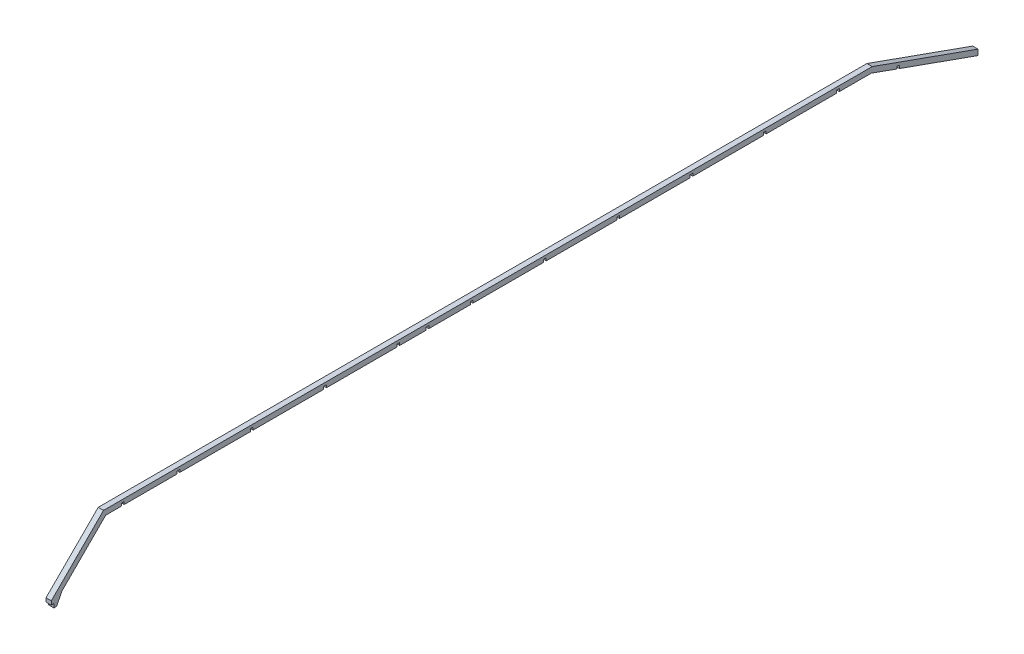
from build123d import *

# Parameters (mm, degrees)
EXTRUDE_3_DEPTH = 6


with BuildPart() as part:
    # Эскиз1 → Бобышка-Вытянуть3 (new body)
    with BuildSketch(Plane(origin=(0, 0, 0), x_dir=(0, 0, -1), z_dir=(1, 0, 0))):
        Polygon((-751.886625415, -19.142158624), (-733.960587786, -19.142158624), (-733.960587786, -16.142158624), (-730.960587786, -16.142158624), (-730.960587786, -19.142158624), (-670.960587786, -19.142158624), (-670.960587786, -16.142158624), (-667.960587786, -16.142158624), (-667.960587786, -19.142158624), (-587.960587786, -19.142158624), (-587.960587786, -16.142158624), (-584.960587786, -16.142158624), (-584.960587786, -19.142158624), (-504.960587786, -19.142158624), (-504.960587786, -16.142158624), (-501.960587786, -16.142158624), (-501.960587786, -19.142158624), (-421.960587786, -19.142158624), (-421.960587786, -16.142158624), (-418.960587786, -16.142158624), (-418.960587786, -19.142158624), (-388.960587786, -19.142158624), (-388.960587786, -16.142158624), (-385.960587786, -16.142158624), (-385.960587786, -19.142158624), (-338.960587786, -19.142158624), (-338.960587786, -16.142158624), (-335.960587786, -16.142158624), (-335.960587786, -19.142158624), (-255.960587786, -19.142158624), (-255.960587786, -16.142158624), (-252.960587786, -16.142158624), (-252.960587786, -19.142158624), (-172.960587786, -19.142158624), (-172.960587786, -16.142158624), (-169.960587786, -16.142158624), (-169.960587786, -19.142158624), (-89.960587786, -19.142158624), (-89.960587786, -16.142158624), (-86.960587786, -16.142158624), (-86.960587786, -19.142158624), (-6.960587786, -19.142158624), (-6.960587786, -16.142158624), (-3.960587786, -16.142158624), (-3.960587786, -19.142158624), (76.039412214, -19.142158624), (76.039412214, -16.142158624), (79.039412214, -16.142158624), (79.039412214, -19.142158624), (115.173374585, -19.142158624), (144.039412214, -29.449285501), (144.039412214, -26.449285501), (147.039412214, -27.520488312), (147.039412214, -30.520488312), (236.039412214, -62.299505021), (236.039412214, -55.928484549), (116.212450849, -13.142158624), (-754.371906789, -13.142158624), (-813.525123531, -72.295375365), (-813.525123531, -76.538016053), (-810.525123531, -76.538016053), (-810.525123531, -80.78065674), (-807.525123531, -80.78065674), (-801.525123531, -68.78065674), align=None)
    extrude(amount=EXTRUDE_3_DEPTH)


solid = part.part
